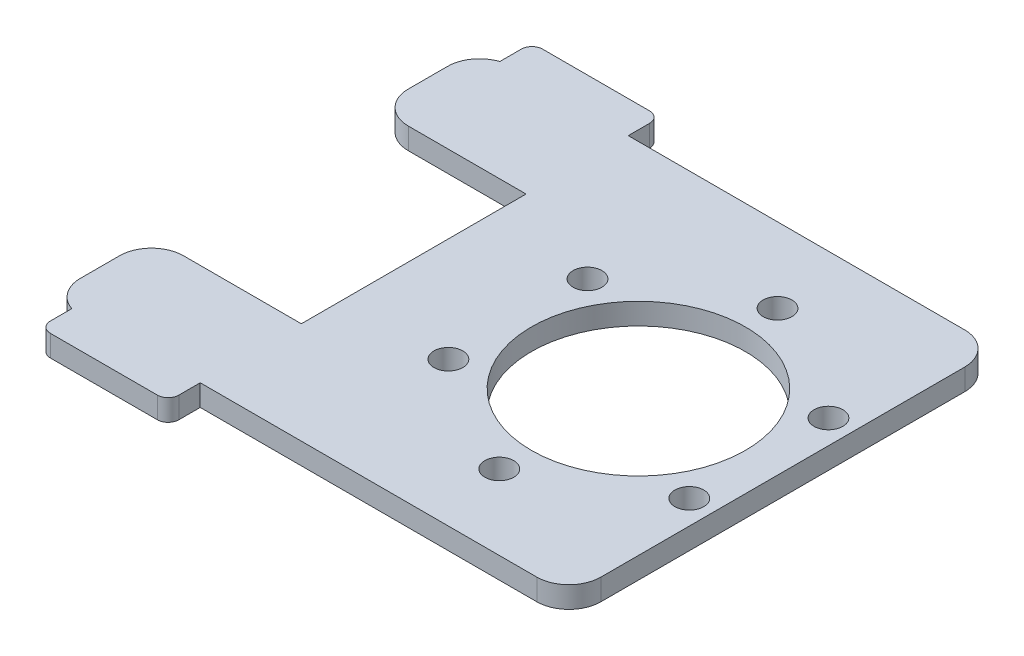
from build123d import *

# Parameters (mm, degrees)
SKETCH_1_W      = 12
SKETCH_1_H      = 3
SKETCH_1_R      = 10
EXTRUDE_1_DEPTH = 2
FILLET_1_R      = 3
FILLET_2_R      = 1


with BuildPart() as part:
    # 草图1 → 凸台-拉伸1 (new body)
    # profile 1 of 4: a face of its own
    with BuildSketch(Plane(origin=(0, 0, 0), x_dir=(1, 0, 0), z_dir=(0, 1, 0))):
        Polygon((-24.25, -10.5), (-24.25, -20), (-22.2, -20), (-10.2, -20), (24.25, -20), (24.25, 20), (-10.2, 20), (-22.2, 20), (-24.25, 20), (-24.25, 10.5), (-10.25, 10.5), (-10.25, -10.5), align=None)
        with BuildLine():
            ThreePointArc((22.621714683, 5.297394688), (23.75, 0), (22.621714683, -5.297394688))
            ThreePointArc((22.621714683, -5.297394688), (23.159540262, -5.794864902), (23.358330249, -6.5))
            ThreePointArc((23.358330249, -6.5), (22.652739816, -7.686269915), (21.273535715, -7.632509158))
            ThreePointArc((21.273535715, -7.632509158), (17.25, -11.258330249), (12.098178968, -12.929903846))
            ThreePointArc((12.098178968, -12.929903846), (12.099544665, -12.964940098), (12.1, -13))
            ThreePointArc((12.1, -13), (10.714940098, -14.349544665), (9.401821032, -12.929903846))
            ThreePointArc((9.401821032, -12.929903846), (4.25, -11.258330249), (0.226464285, -7.632509158))
            ThreePointArc((0.226464285, -7.632509158), (-1.677464544, -7.175), (-1.121714683, -5.297394688))
            ThreePointArc((-1.121714683, -5.297394688), (-2.25, 0), (-1.121714683, 5.297394688))
            ThreePointArc((-1.121714683, 5.297394688), (-1.677464544, 7.175), (0.226464285, 7.632509158))
            ThreePointArc((0.226464285, 7.632509158), (4.25, 11.258330249), (9.401821032, 12.929903846))
            ThreePointArc((9.401821032, 12.929903846), (10.714940098, 14.349544665), (12.1, 13))
            ThreePointArc((12.1, 13), (12.099544665, 12.964940098), (12.098178968, 12.929903846))
            ThreePointArc((12.098178968, 12.929903846), (17.25, 11.258330249), (21.273535715, 7.632509158))
            ThreePointArc((21.273535715, 7.632509158), (22.652739816, 7.686269915), (23.358330249, 6.5))
            ThreePointArc((23.358330249, 6.5), (23.159540262, 5.794864902), (22.621714683, 5.297394688))
        make_face(mode=Mode.SUBTRACT)
    # profile 2 of 4: a face of its own
    with BuildSketch(Plane(origin=(0, 0, 0), x_dir=(1, 0, 0), z_dir=(0, 1, 0))):
        with Locations((-16.2, 21.5)):
            Rectangle(SKETCH_1_W, SKETCH_1_H)
    # profile 3 of 4: a face of its own
    with BuildSketch(Plane(origin=(0, 0, 0), x_dir=(1, 0, 0), z_dir=(0, 1, 0))):
        with Locations((-16.2, -21.5)):
            Rectangle(SKETCH_1_W, SKETCH_1_H)
    # profile 4 of 4: a face of its own
    with BuildSketch(Plane(origin=(0, 0, 0), x_dir=(1, 0, 0), z_dir=(0, 1, 0))):
        with BuildLine():
            ThreePointArc((21.273535715, -7.632509158), (20.839195954, -5.825), (22.621714683, -5.297394688))
            ThreePointArc((22.621714683, -5.297394688), (23.75, 0), (22.621714683, 5.297394688))
            ThreePointArc((22.621714683, 5.297394688), (20.839195954, 5.825), (21.273535715, 7.632509158))
            ThreePointArc((21.273535715, 7.632509158), (17.25, 11.258330249), (12.098178968, 12.929903846))
            ThreePointArc((12.098178968, 12.929903846), (10.75, 11.65), (9.401821032, 12.929903846))
            ThreePointArc((9.401821032, 12.929903846), (4.25, 11.258330249), (0.226464285, 7.632509158))
            ThreePointArc((0.226464285, 7.632509158), (0.677939665, 7.144409567), (0.841669751, 6.5))
            ThreePointArc((0.841669751, 6.5), (0.196804849, 5.348789987), (-1.121714683, 5.297394688))
            ThreePointArc((-1.121714683, 5.297394688), (-2.25, 0), (-1.121714683, -5.297394688))
            ThreePointArc((-1.121714683, -5.297394688), (0.196804849, -5.348789987), (0.841669751, -6.5))
            ThreePointArc((0.841669751, -6.5), (0.677939665, -7.144409567), (0.226464285, -7.632509158))
            ThreePointArc((0.226464285, -7.632509158), (4.25, -11.258330249), (9.401821032, -12.929903846))
            ThreePointArc((9.401821032, -12.929903846), (10.75, -11.65), (12.098178968, -12.929903846))
            ThreePointArc((12.098178968, -12.929903846), (17.25, -11.258330249), (21.273535715, -7.632509158))
        make_face()
        with Locations(Location((10.75, 0, 0), (0, 0, 270))):
            Circle(SKETCH_1_R, mode=Mode.SUBTRACT)
    extrude(amount=EXTRUDE_1_DEPTH)

    # 圆角1
    # the kernel refuses this fillet: 3 mm, written as the material it takes off along each edge
    with BuildSketch(Plane(origin=(-24.25, -7.5, -10.5), x_dir=(1, 0, 0), z_dir=(0, 1, 0)), Plane(origin=(24.25, -7.5, -20), x_dir=(-1, 0, 0), z_dir=(0, 1, 0)), Plane(origin=(24.25, -7.5, 20), x_dir=(0, 0, -1), z_dir=(0, 1, 0)), Plane(origin=(-24.25, -7.5, 10.5), x_dir=(0, 0, 1), z_dir=(0, 1, 0))) as fillet_1_piece_1:
        with BuildLine():
            CenterArc((FILLET_1_R, FILLET_1_R), FILLET_1_R, 180, 90)
            Line((0, FILLET_1_R), (-FILLET_1_R * 0.02, FILLET_1_R))
            Line((-FILLET_1_R * 0.02, FILLET_1_R), (-FILLET_1_R * 0.02, -FILLET_1_R * 0.02))
            Line((-FILLET_1_R * 0.02, -FILLET_1_R * 0.02), (FILLET_1_R, -FILLET_1_R * 0.02))
            Line((FILLET_1_R, -FILLET_1_R * 0.02), (FILLET_1_R, 0))
        make_face()
    extrude(amount=17, mode=Mode.SUBTRACT)
    with BuildSketch(Plane(origin=(-24.25, -7.114026638, -20), x_dir=(0, 0, 1), z_dir=(0, 1, 0))) as fillet_1_piece_2:
        with BuildLine():
            CenterArc((2.845610655, 3), FILLET_1_R, 198.461458297, 71.538541703)
            Line((0, 2.05), (-0.056912213, 2.031))
            ThreePointArc((-0.056912213, 2.031), (-0.06, 1.025), (-0.06, 0))
            Line((-0.06, 0), (0, -0.06))
            Line((0, -0.06), (2.845610655, -0.06))
            Line((2.845610655, -0.06), (2.845610655, 0))
        make_face()
    extrude(amount=16.228053275, mode=Mode.SUBTRACT)
    with BuildSketch(Plane(origin=(-24.25, -7.114026638, 20), x_dir=(0, 0, -1), z_dir=(0, 1, 0))) as fillet_1_piece_3:
        with BuildLine():
            CenterArc((2.845610655, -3), FILLET_1_R, 90, 71.538541703)
            Line((0, -2.05), (-0.056912213, -2.031))
            ThreePointArc((-0.056912213, -2.031), (-0.06, -1.025), (-0.06, 0))
            Line((-0.06, 0), (0, 0.06))
            Line((0, 0.06), (2.845610655, 0.06))
            Line((2.845610655, 0.06), (2.845610655, 0))
        make_face()
    extrude(amount=16.228053275, mode=Mode.SUBTRACT)

    # 圆角2
    fillet_2_edges = [part.edges().sort_by_distance(p)[0] for p in [
        (-22.2, 1, -23),
        (-10.2, 1, -23),
        (-10.2, 1, 23),
        (-22.2, 1, 23),
    ]]
    fillet(fillet_2_edges, radius=FILLET_2_R)


solid = part.part
